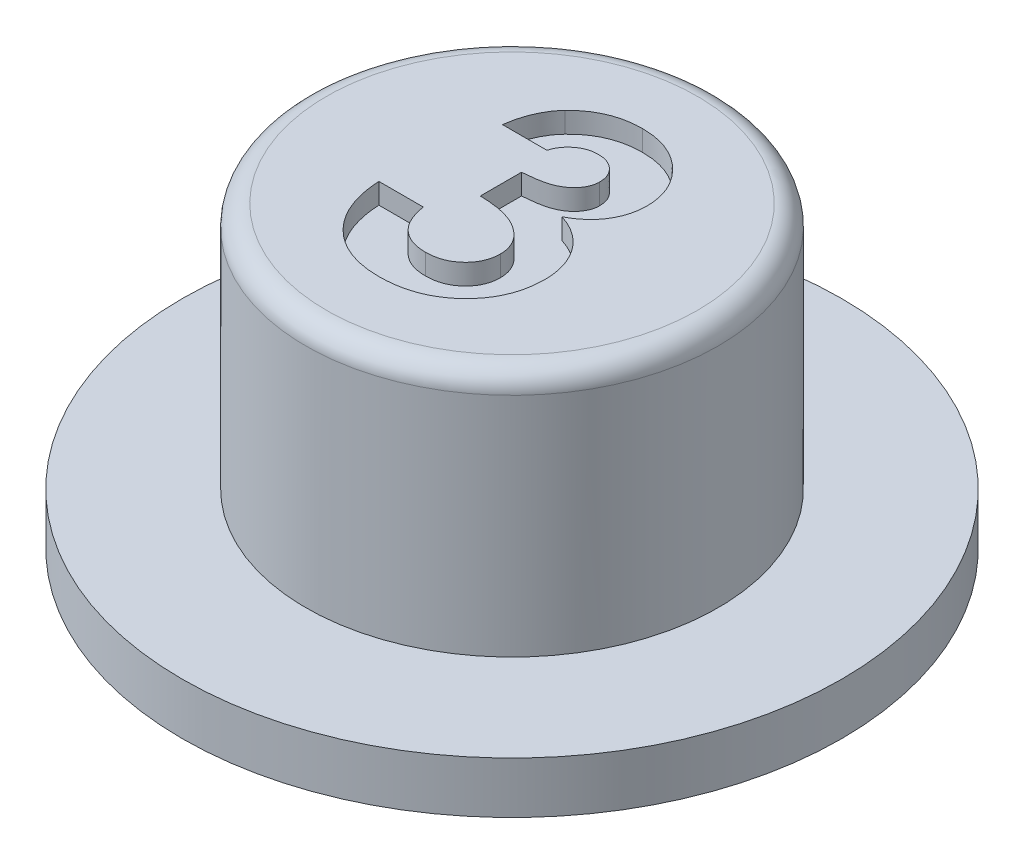
from build123d import *

# Parameters (mm, degrees)
SKETCH2_W          = 3.5
SKETCH2_H          = 2.5
CUT_EXTRUDE1_DEPTH = 3.5
FILLET1_R          = 0.5
CUT_EXTRUDE2_DEPTH = 0.5


with BuildPart() as part:
    # Sketch1 → Revolve1 (revolve)
    with BuildSketch(Plane.XY):
        Polygon((0, 7.25), (5, 7.25), (5, 1.25), (8, 1.25), (8, 0), (0, 0), align=None)
    revolve(axis=Axis((0, 7.25, 0), (0, -1, 0)))

    # Sketch2 → Cut-Extrude1 (cut)
    with BuildSketch(Plane.XZ):
        Rectangle(SKETCH2_W, SKETCH2_H)
    extrude(amount=-CUT_EXTRUDE1_DEPTH, mode=Mode.SUBTRACT)

    # Fillet1
    fillet1_edges = [part.edges().sort_by_distance(p)[0] for p in [
        (-5, 7.25, 0),
    ]]
    fillet(fillet1_edges, radius=FILLET1_R)

    # Sketch3 → Cut-Extrude2 (cut)
    with BuildSketch(Plane(origin=(0, 7.25, 0), x_dir=(1, 0, 0), z_dir=(0, 1, 0))):
        with BuildLine():
            Line((-0.692307692, 1.538461538), (-1.769230769, 1.538461538))
            add(Edge.make_bspline(
                [(-1.769230769, 1.538461538), (-1.761627283, 1.592293081), (-1.746721151, 1.697826255), (-1.711052772, 1.850612001), (-1.668389541, 1.995539737), (-1.615126677, 2.132150507), (-1.552658003, 2.26068766), (-1.481618755, 2.381592272), (-1.401240972, 2.494345399), (-1.339630551, 2.56226833), (-1.308894231, 2.596153846)],
                knots=[0, 0, 0, 0, 1.111473889, 2.178970933, 3.205615836, 4.199322666, 5.174200091, 6.12565194, 7.064921805, 8, 8, 8, 8], degree=3))
            add(Edge.make_bspline(
                [(-1.308894231, 2.596153846), (-1.264561162, 2.64086333), (-1.177185342, 2.728981023), (-1.0311701, 2.841850054), (-0.87811916, 2.939530525), (-0.714963019, 3.016972309), (-0.54424051, 3.079652462), (-0.364593988, 3.121754862), (-0.176757553, 3.149690176), (-0.048582817, 3.152441902), (0.016826923, 3.153846154)],
                knots=[0, 0, 0, 0, 1.01925491, 2.00884431, 2.983262333, 3.955970413, 4.92937149, 5.924503185, 6.940838805, 8, 8, 8, 8], degree=3))
            add(Edge.make_bspline(
                [(0.016826923, 3.153846154), (0.074979548, 3.152473284), (0.189295889, 3.1497745), (0.357312147, 3.12811012), (0.517501588, 3.09011321), (0.671557461, 3.040433102), (0.817214107, 2.972835014), (0.957686309, 2.894368021), (1.089049269, 2.798124993), (1.21161035, 2.689380057), (1.324206079, 2.571761763), (1.421714474, 2.44603748), (1.50554419, 2.315565593), (1.574608788, 2.179262127), (1.627710079, 2.03689644), (1.66456395, 1.889290961), (1.688685703, 1.73677139), (1.69108886, 1.633105893), (1.692307692, 1.580528846)],
                knots=[0, 0, 0, 0, 1.091422571, 2.145516843, 3.172569842, 4.178562979, 5.178154469, 6.181868002, 7.194278174, 8.227918432, 9.254613415, 10.245994977, 11.209837596, 12.161663635, 13.10878368, 14.055455738, 15.013766427, 16, 16, 16, 16], degree=3))
            add(Edge.make_bspline(
                [(1.692307692, 1.580528846), (1.689806575, 1.515416552), (1.684882644, 1.387230464), (1.644478223, 1.1996206), (1.581234318, 1.02023209), (1.489872345, 0.851574848), (1.37564661, 0.694107866), (1.235495458, 0.553095736), (1.073410758, 0.42632758), (0.951731615, 0.358202358), (0.889423077, 0.323317308)],
                knots=[0, 0, 0, 0, 0.992805628, 1.954529043, 2.915727527, 3.886831945, 4.871318353, 5.87440735, 6.911542536, 8, 8, 8, 8], degree=3))
            add(Edge.make_bspline(
                [(0.889423077, 0.323317308), (0.932190702, 0.309275796), (1.016227167, 0.281684855), (1.135674897, 0.227344809), (1.249256039, 0.167960147), (1.355014768, 0.098970823), (1.45400298, 0.02316646), (1.545617233, -0.060100944), (1.6304049, -0.150649828), (1.706981857, -0.248978177), (1.774946898, -0.353513419), (1.83592831, -0.461840853), (1.886119412, -0.575603284), (1.928637524, -0.693501468), (1.961008393, -0.816595012), (1.983800378, -0.944406938), (1.996974705, -1.0766457), (1.998984014, -1.166237381), (2, -1.211538462)],
                knots=[0, 0, 0, 0, 1.059543567, 2.081955587, 3.086750234, 4.076226789, 5.052108497, 6.020845489, 6.989030705, 7.970690546, 8.952259656, 9.923888338, 10.895517021, 11.877585046, 12.873342345, 13.889638361, 14.932918083, 16, 16, 16, 16], degree=3))
            add(Edge.make_bspline(
                [(2, -1.211538462), (1.99794046, -1.278112657), (1.993879466, -1.409383412), (1.96806157, -1.602731801), (1.919993298, -1.787072311), (1.856756824, -1.964526059), (1.772406231, -2.132802181), (1.673139763, -2.295762385), (1.55112133, -2.447755255), (1.415518792, -2.59279909), (1.264924269, -2.72466645), (1.101655307, -2.838989517), (0.92930205, -2.937099049), (0.746774068, -3.016747163), (0.554134775, -3.07808532), (0.351813548, -3.122423367), (0.138960288, -3.149550117), (-0.006328716, -3.152393843), (-0.080528846, -3.153846154)],
                knots=[0, 0, 0, 0, 1.005138573, 1.981928558, 2.936866704, 3.876260664, 4.820238198, 5.773547, 6.751179199, 7.756627054, 8.768222608, 9.766606018, 10.760583154, 11.757261445, 12.767156078, 13.807575856, 14.880313354, 16, 16, 16, 16], degree=3))
            add(Edge.make_bspline(
                [(-0.080528846, -3.153846154), (-0.150720973, -3.152314938), (-0.287972388, -3.149320847), (-0.488731308, -3.123405473), (-0.679533658, -3.081601873), (-0.860866369, -3.022676231), (-1.032027879, -2.946259745), (-1.194570348, -2.855264855), (-1.345250276, -2.744443189), (-1.485746535, -2.618797446), (-1.612942493, -2.477830056), (-1.726625726, -2.324806459), (-1.824289498, -2.15914477), (-1.90633433, -1.981552763), (-1.972118816, -1.791718889), (-2.024009425, -1.590029185), (-2.060255866, -1.376089611), (-2.071294795, -1.228894633), (-2.076923077, -1.153846154)],
                knots=[0, 0, 0, 0, 1.066544725, 2.085487077, 3.070979577, 4.031932826, 4.977951092, 5.916076795, 6.857635327, 7.814973522, 8.776389752, 9.738577119, 10.707772778, 11.69409279, 12.707140348, 13.757286496, 14.856535458, 16, 16, 16, 16], degree=3))
            Line((-2.076923077, -1.153846154), (-1, -1.153846154))
            add(Edge.make_bspline(
                [(-1, -1.153846154), (-0.993175651, -1.191581514), (-0.979883441, -1.265081025), (-0.953957801, -1.371491977), (-0.920173075, -1.469715859), (-0.881109526, -1.56062568), (-0.838915012, -1.645415056), (-0.78793395, -1.720952506), (-0.731901962, -1.78928918), (-0.651047396, -1.870528571), (-0.535460225, -1.953998654), (-0.37937925, -2.026538127), (-0.205753946, -2.069055171), (-0.084372543, -2.074242119), (-0.021634615, -2.076923077)],
                knots=[0, 0, 0, 0, 0.928156231, 1.807827665, 2.648129825, 3.438902246, 4.202261636, 4.936546065, 5.639352463, 6.338805438, 7.70633318, 9.064371875, 10.482673459, 12, 12, 12, 12], degree=3))
            add(Edge.make_bspline(
                [(-0.021634615, -2.076923077), (0.011656347, -2.076352192), (0.076865893, -2.075233957), (0.172649007, -2.062839815), (0.26389591, -2.042426653), (0.350776553, -2.014685923), (0.433844025, -1.979911184), (0.511511237, -1.935071238), (0.585361242, -1.8829384), (0.654591223, -1.824327251), (0.718561152, -1.760462079), (0.771787895, -1.689742251), (0.820433287, -1.617878267), (0.856411769, -1.54016853), (0.88793667, -1.460794654), (0.90723152, -1.376875618), (0.921800518, -1.290171816), (0.92264721, -1.23083554), (0.923076923, -1.200721154)],
                knots=[0, 0, 0, 0, 1.110435564, 2.175094844, 3.216326037, 4.226890168, 5.215276772, 6.21526065, 7.213097102, 8.228249917, 9.239874822, 10.221364777, 11.178138315, 12.128914389, 13.072518965, 14.022636769, 14.996447288, 16, 16, 16, 16], degree=3))
            add(Edge.make_bspline(
                [(0.923076923, -1.200721154), (0.921936114, -1.167785942), (0.919665025, -1.102219481), (0.901109988, -1.006539018), (0.871807663, -0.914502124), (0.831103154, -0.826516381), (0.776746819, -0.742906088), (0.71260695, -0.66199377), (0.633630386, -0.587990767), (0.546982519, -0.514841041), (0.446505033, -0.451076542), (0.337091322, -0.392231279), (0.215865824, -0.345408616), (0.085787762, -0.303587306), (-0.055603411, -0.27304167), (-0.207429711, -0.250862562), (-0.369446217, -0.234353653), (-0.481126301, -0.231985178), (-0.538461538, -0.230769231)],
                knots=[0, 0, 0, 0, 0.809814727, 1.612155564, 2.388397, 3.182215007, 3.988903953, 4.837162975, 5.715530372, 6.646997145, 7.623086902, 8.637258368, 9.698941581, 10.815059213, 11.996518529, 13.252603015, 14.589518788, 16, 16, 16, 16], degree=3))
            Line((-0.538461538, -0.230769231), (-0.538461538, 0.769230769))
            add(Edge.make_bspline(
                [(-0.538461538, 0.769230769), (-0.467075758, 0.775310211), (-0.333527098, 0.786683642), (-0.148154398, 0.813280806), (0.007905519, 0.848832295), (0.138403557, 0.891723242), (0.246760767, 0.946806392), (0.341421027, 1.007615757), (0.42294692, 1.078236948), (0.491847236, 1.156564051), (0.546965345, 1.240680013), (0.585974732, 1.329277425), (0.611734493, 1.419614974), (0.614175229, 1.481403134), (0.615384615, 1.512019231)],
                knots=[0, 0, 0, 0, 1.70044513, 3.18119609, 4.440695891, 5.496282586, 6.431922213, 7.318171381, 8.16090191, 8.983045123, 9.787564368, 10.536848927, 11.275007137, 12, 12, 12, 12], degree=3))
            add(Edge.make_bspline(
                [(0.615384615, 1.512019231), (0.613298077, 1.551082046), (0.609225595, 1.627324392), (0.577596497, 1.73644325), (0.522691967, 1.833713668), (0.449074632, 1.918930961), (0.35936935, 1.990110831), (0.254219034, 2.041786203), (0.135905452, 2.072147791), (0.052665473, 2.075295265), (0.009615385, 2.076923077)],
                knots=[0, 0, 0, 0, 1.009664648, 1.970651636, 2.907870547, 3.878035693, 4.867062054, 5.849714035, 6.887914197, 8, 8, 8, 8], degree=3))
            add(Edge.make_bspline(
                [(0.009615385, 2.076923077), (-0.02940468, 2.07500243), (-0.106832439, 2.071191279), (-0.220054998, 2.042745855), (-0.327578707, 1.994861524), (-0.427177053, 1.928831853), (-0.517412316, 1.849533017), (-0.591469432, 1.755620006), (-0.653066629, 1.652719311), (-0.679176059, 1.57669677), (-0.692307692, 1.538461538)],
                knots=[0, 0, 0, 0, 0.98818071, 1.960853194, 2.938124878, 3.957524365, 4.978590984, 5.968022688, 6.978025184, 8, 8, 8, 8], degree=3))
        make_face()
    extrude(amount=-CUT_EXTRUDE2_DEPTH, mode=Mode.SUBTRACT)


solid = part.part
